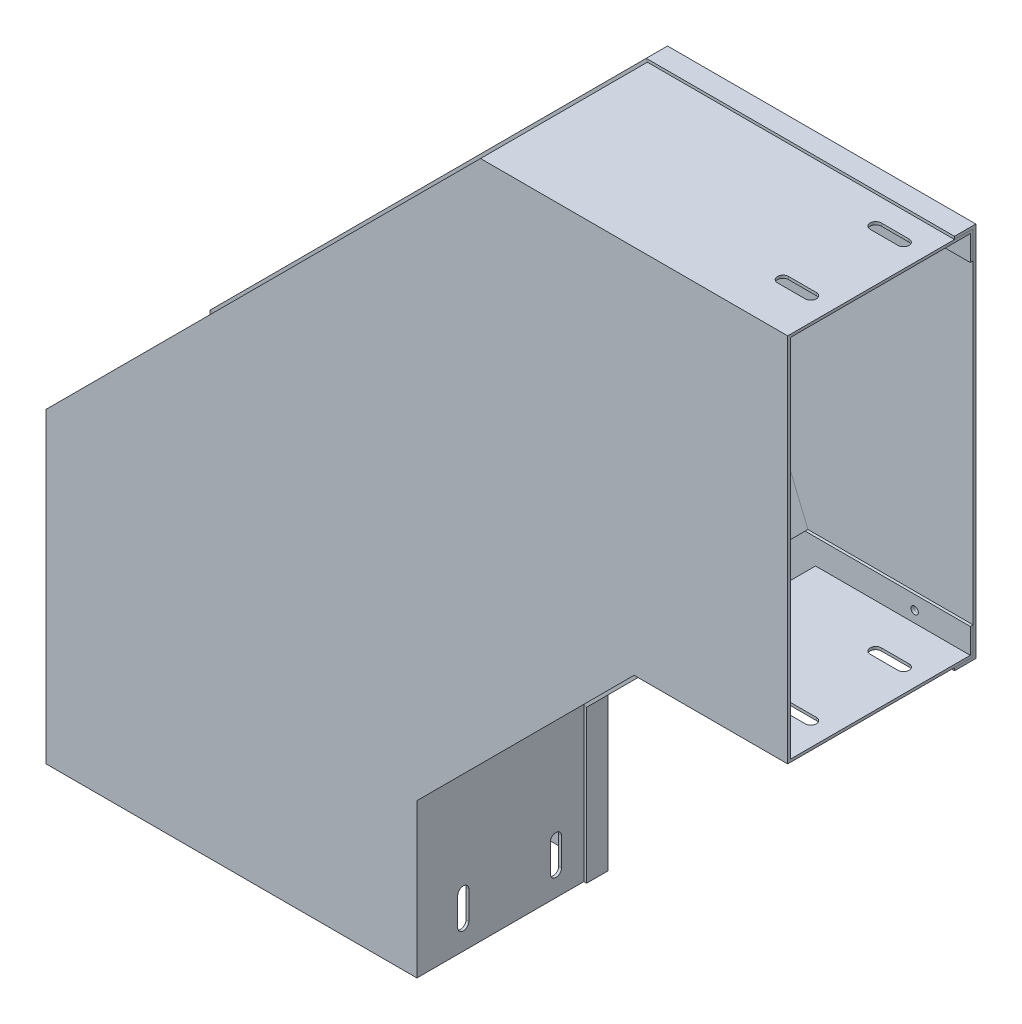
from build123d import *

# Parameters (mm, degrees)
CUT_EXTRUDE1_DEPTH      = 503.493781056
CUT_EXTRUDE1_DEPTH_BACK = 503.493781056
CUT_EXTRUDE2_DEPTH      = 503.493781056
CUT_EXTRUDE2_DEPTH_BACK = 503.493781056
SKETCH4_R               = 2
CUT_EXTRUDE3_DEPTH      = 568.89083458
CUT_EXTRUDE4_REACH      = 569.891
SKETCH5_R               = 2
SKETCH10_R              = 2
CUT_EXTRUDE5_DEPTH      = 571.13748342
SKETCH11_R              = 2
CUT_EXTRUDE6_DEPTH      = 571.13748342


with BuildPart() as part:
    # Sweep1: sweep along a path in ElbowArc
    with BuildLine(Plane.XY) as sweep1_path:
        Line((-300, 0), (-300, 124.264068712))
        Line((-300, 124.264068712), (-124.264068712, 300))
        Line((-124.264068712, 300), (0, 300))
    # Sketch1 → Sweep1 (sweep)
    with BuildSketch(Plane(origin=(0, 0, 0), x_dir=(1, 0, 0), z_dir=(0, 1, 0))):
        Polygon((-200, -50), (-400, -50), (-400, 50), (-385, 50), (-385, 48.5), (-398.5, 48.5), (-398.5, -48.5), (-201.5, -48.5), (-201.5, 48.5), (-215, 48.5), (-215, 50), (-200, 50), align=None)
    sweep(path=sweep1_path.line, transition=Transition.RIGHT)

    # Sketch2 → Cut-Extrude1 (cut, two sides: drawn at the far end of the back side and taken through both)
    with BuildSketch(Plane(origin=(-300, 0, 0), x_dir=(0, 0, -1), z_dir=(1, 0, 0)).offset(-CUT_EXTRUDE1_DEPTH_BACK)):
        with BuildLine():
            Line((-28, 12.5), (-28, 27.5))
            ThreePointArc((-28, 27.5), (-25, 30.5), (-22, 27.5))
            Line((-22, 27.5), (-22, 12.5))
            ThreePointArc((-22, 12.5), (-25, 9.5), (-28, 12.5))
        make_face()
        with BuildLine():
            Line((22, 12.5), (22, 27.5))
            ThreePointArc((22, 27.5), (25, 30.5), (28, 27.5))
            Line((28, 27.5), (28, 12.5))
            ThreePointArc((28, 12.5), (25, 9.5), (22, 12.5))
        make_face()
    extrude(amount=CUT_EXTRUDE1_DEPTH + CUT_EXTRUDE1_DEPTH_BACK, mode=Mode.SUBTRACT)

    # Sketch3 → Cut-Extrude2 (cut, two sides: drawn at the far end of the back side and taken through both)
    with BuildSketch(Plane(origin=(0, 300, 0), x_dir=(-1, 0, 0), z_dir=(0, 1, 0)).offset(-CUT_EXTRUDE2_DEPTH_BACK)):
        with BuildLine():
            Line((12.5, 28), (27.5, 28))
            ThreePointArc((27.5, 28), (30.5, 25), (27.5, 22))
            Line((27.5, 22), (12.5, 22))
            ThreePointArc((12.5, 22), (9.5, 25), (12.5, 28))
        make_face()
        with BuildLine():
            Line((12.5, -22), (27.5, -22))
            ThreePointArc((27.5, -22), (30.5, -25), (27.5, -28))
            Line((27.5, -28), (12.5, -28))
            ThreePointArc((12.5, -28), (9.5, -25), (12.5, -22))
        make_face()
    extrude(amount=CUT_EXTRUDE2_DEPTH + CUT_EXTRUDE2_DEPTH_BACK, mode=Mode.SUBTRACT)

    # Sketch4 → Cut-Extrude3 (cut, through all)
    with BuildSketch(Plane(origin=(0, 0, 0), x_dir=(-1, 0, 0), z_dir=(0, 0, -1))):
        with Locations((392.5, 30)):
            Circle(SKETCH4_R)
        with Locations((207.5, 30)):
            Circle(SKETCH4_R)
    extrude(amount=CUT_EXTRUDE3_DEPTH, mode=Mode.SUBTRACT)

    # Sketch5 → Cut-Extrude4 (cut, up to next)
    with BuildSketch(Plane.XY, mode=Mode.PRIVATE) as cut_extrude4_sk1:
        with Locations((-30, 392.5)):
            Circle(SKETCH5_R)
    cut_extrude4_tool1 = extrude(cut_extrude4_sk1.sketch, amount=-CUT_EXTRUDE4_REACH, mode=Mode.PRIVATE) & part.part
    # Sketch5 → Cut-Extrude4 (cut, up to next)
    with BuildSketch(Plane.XY, mode=Mode.PRIVATE) as cut_extrude4_sk2:
        with Locations((-30, 207.5)):
            Circle(SKETCH5_R)
    cut_extrude4_tool2 = extrude(cut_extrude4_sk2.sketch, amount=-CUT_EXTRUDE4_REACH, mode=Mode.PRIVATE) & part.part
    add(cut_extrude4_tool1.solids().sort_by_distance((-30, 392.5, 0))[0], mode=Mode.SUBTRACT)
    add(cut_extrude4_tool2.solids().sort_by_distance((-30, 207.5, 0))[0], mode=Mode.SUBTRACT)


with BuildPart() as body_2:
    # Sweep2: sweep along a path in ElbowArc<2>
    with BuildLine(Plane.XY) as sweep2_path:
        Line((-300, 0), (-300, 124.264068712))
        Line((-300, 124.264068712), (-124.264068712, 300))
        Line((-124.264068712, 300), (0, 300))
    # Sketch8 → Sweep2 (sweep)
    with BuildSketch(Plane(origin=(0, 0, 0), x_dir=(1, 0, 0), z_dir=(0, 1, 0))):
        Polygon((-400, 40), (-400, 50), (-200, 50), (-200, 40), (-198.5, 40), (-198.5, 51.5), (-401.5, 51.5), (-401.5, 40), align=None)
    sweep(path=sweep2_path.line, transition=Transition.RIGHT)

    # Sketch10 → Cut-Extrude5 (cut, through all)
    with BuildSketch(Plane(origin=(0, 0, 0), x_dir=(0, 1, 0), z_dir=(0, 0, 1))):
        with Locations((30, 207.5)):
            Circle(SKETCH10_R)
        with Locations((30, 392.5)):
            Circle(SKETCH10_R)
    extrude(amount=-CUT_EXTRUDE5_DEPTH, mode=Mode.SUBTRACT)

    # Sketch11 → Cut-Extrude6 (cut, through all)
    with BuildSketch(Plane.XY):
        with Locations((-30, 207.5)):
            Circle(SKETCH11_R)
        with Locations((-30, 392.5)):
            Circle(SKETCH11_R)
    extrude(amount=-CUT_EXTRUDE6_DEPTH, mode=Mode.SUBTRACT)


solid = Compound([part.part, body_2.part])
